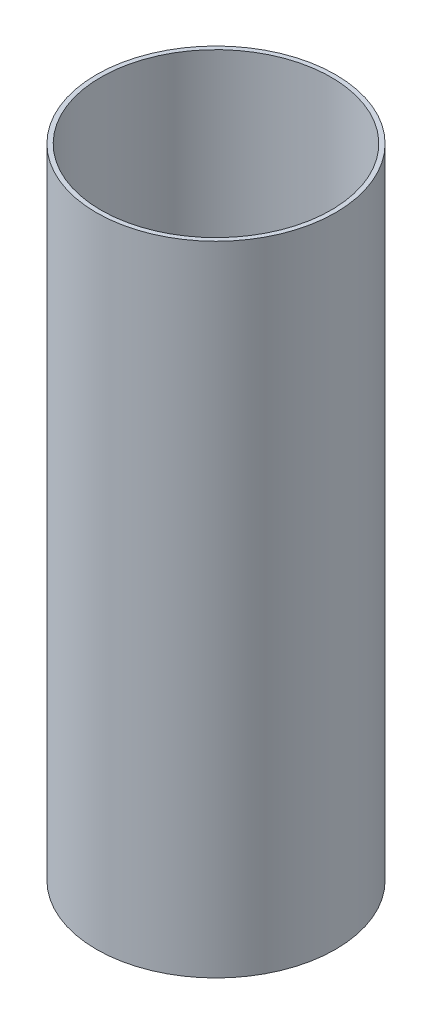
from build123d import *

# Parameters (mm, degrees)
COUPLER_PROFILE_R   = 76.1746
COUPLER_PROFILE_R_2 = 73.3425
COUPLER_BODY_DEPTH  = 406.4


with BuildPart() as part:
    # Coupler Profile → Coupler Body (new body)
    with BuildSketch(Plane(origin=(0, 0, 0), x_dir=(1, 0, 0), z_dir=(0, 1, 0))):
        Circle(COUPLER_PROFILE_R)
        Circle(COUPLER_PROFILE_R_2, mode=Mode.SUBTRACT)
    extrude(amount=COUPLER_BODY_DEPTH)


solid = part.part
